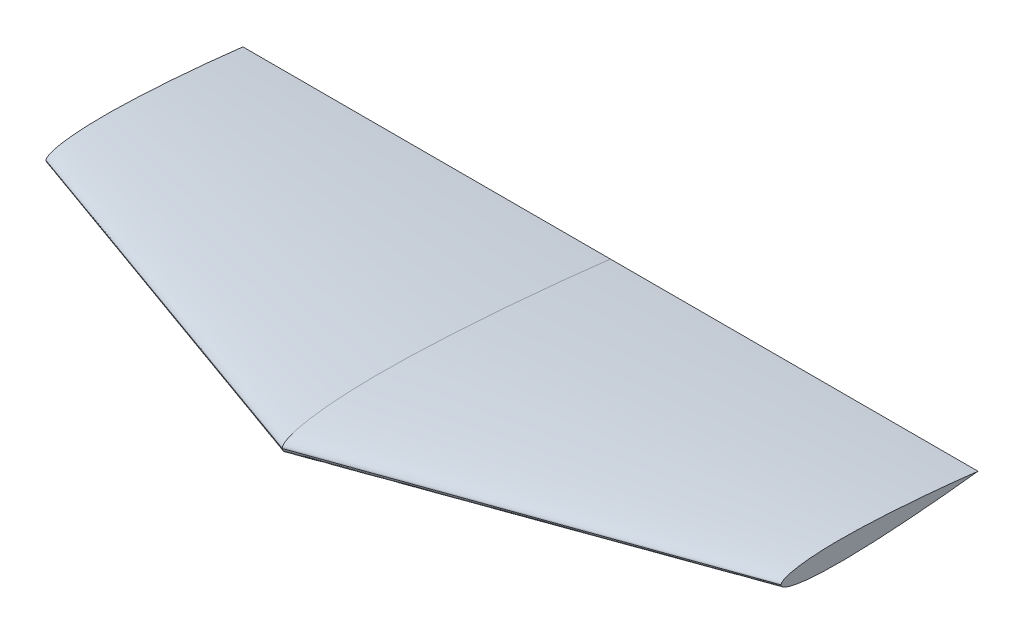
from build123d import *


with BuildPart() as part:
    # Sketch3 → Loft1 section 0
    with BuildSketch(Plane(origin=(0, 0, 0), x_dir=(0, 0, -1), z_dir=(1, 0, 0))):
        with BuildLine():
            add(Edge.make_bspline(
                [(-250, 0), (-249.999895281, 0.195763361), (-249.961151424, 0.603923402), (-249.75955923, 1.263250946), (-249.128153903, 2.239806839), (-248.109823795, 3.175235862), (-246.576102635, 4.182773144), (-244.127109162, 5.366692622), (-240.073872734, 6.817923154), (-232.840047676, 8.611288496), (-221.29446773, 10.449653683), (-205.80771311, 11.81775272), (-187.49226418, 12.532505163), (-167.615673922, 12.562370188), (-147.96130587, 12.104155942), (-127.983093335, 11.220881059), (-108.565528946, 10.107332464), (-88.272495474, 8.647865064), (-69.457807346, 7.164126414), (-48.249165687, 5.205040487), (-31.044142862, 3.54737405), (-13.203762803, 1.558807082), (-4.467222803, 0.541092362), (0, 0)],
                knots=[0, 0, 0, 0, 0, 0.0027914, 0.005882719, 0.009734657, 0.016522403, 0.022438151, 0.032158027, 0.04863424, 0.078248652, 0.129036717, 0.199997011, 0.270957307, 0.341917602, 0.412877898, 0.483838194, 0.554798491, 0.625758787, 0.696719083, 0.767679379, 0.838639675, 0.909599973, 0.909599973, 0.909599973, 0.909599973, 0.909599973], degree=4))
            add(Edge.make_bspline(
                [(-250, 0), (-249.999895281, -0.195763361), (-249.961151424, -0.603923402), (-249.75955923, -1.263250946), (-249.128153903, -2.239806839), (-248.109823795, -3.175235862), (-246.576102635, -4.182773144), (-244.127109162, -5.366692622), (-240.073872734, -6.817923154), (-232.840047676, -8.611288496), (-221.29446773, -10.449653683), (-205.80771311, -11.81775272), (-187.49226418, -12.532505163), (-167.615673922, -12.562370188), (-147.96130587, -12.104155942), (-127.983093335, -11.220881059), (-108.565528946, -10.107332464), (-88.272495474, -8.647865064), (-69.457807346, -7.164126414), (-48.249165687, -5.205040487), (-31.044142862, -3.54737405), (-13.203762803, -1.558807082), (-4.467222803, -0.541092362), (0, 0)],
                knots=[0, 0, 0, 0, 0, 0.0027914, 0.005882719, 0.009734657, 0.016522403, 0.022438151, 0.032158027, 0.04863424, 0.078248652, 0.129036717, 0.199997011, 0.270957307, 0.341917602, 0.412877898, 0.483838194, 0.554798491, 0.625758787, 0.696719083, 0.767679379, 0.838639675, 0.909599973, 0.909599973, 0.909599973, 0.909599973, 0.909599973], degree=4))
        make_face()
    # Sketch4 → Loft1 section 1
    with BuildSketch(Plane(origin=(280, 0, 0), x_dir=(0, 0, -1), z_dir=(1, 0, 0))):
        with BuildLine():
            add(Edge.make_bspline(
                [(-150, 0), (-149.999937168, 0.117458016), (-149.976690854, 0.362354041), (-149.855735538, 0.757950568), (-149.476892342, 1.343884103), (-148.865894277, 1.905141517), (-147.945661581, 2.509663886), (-146.476265497, 3.220015573), (-144.04432364, 4.090753893), (-139.704028605, 5.166773097), (-132.776680638, 6.26979221), (-123.484627866, 7.090651632), (-112.495358508, 7.519503098), (-100.569404353, 7.537422113), (-88.776783522, 7.262493565), (-76.789856001, 6.732528635), (-65.139317368, 6.064399479), (-52.963497284, 5.188719038), (-41.674684407, 4.298475849), (-28.949499412, 3.123024292), (-18.626485717, 2.12842443), (-7.922257682, 0.935284249), (-2.680333682, 0.324655417), (0, 0)],
                knots=[0, 0, 0, 0, 0, 0.0027914, 0.005882719, 0.009734657, 0.016522403, 0.022438151, 0.032158027, 0.04863424, 0.078248652, 0.129036717, 0.199997011, 0.270957307, 0.341917602, 0.412877898, 0.483838194, 0.554798491, 0.625758787, 0.696719083, 0.767679379, 0.838639675, 0.909599973, 0.909599973, 0.909599973, 0.909599973, 0.909599973], degree=4))
            add(Edge.make_bspline(
                [(-150, 0), (-149.999937169, -0.117458016), (-149.976690854, -0.362354041), (-149.855735538, -0.757950568), (-149.476892342, -1.343884103), (-148.865894277, -1.905141517), (-147.945661581, -2.509663886), (-146.476265497, -3.220015573), (-144.04432364, -4.090753893), (-139.704028605, -5.166773097), (-132.776680638, -6.26979221), (-123.484627866, -7.090651632), (-112.495358508, -7.519503098), (-100.569404353, -7.537422113), (-88.776783522, -7.262493565), (-76.789856001, -6.732528635), (-65.139317368, -6.064399479), (-52.963497285, -5.188719038), (-41.674684407, -4.298475849), (-28.949499412, -3.123024292), (-18.626485717, -2.12842443), (-7.922257682, -0.935284249), (-2.680333682, -0.324655417), (0, 0)],
                knots=[0, 0, 0, 0, 0, 0.0027914, 0.005882719, 0.009734657, 0.016522403, 0.022438151, 0.032158027, 0.04863424, 0.078248652, 0.129036717, 0.199997011, 0.270957307, 0.341917602, 0.412877898, 0.483838194, 0.554798491, 0.625758787, 0.696719083, 0.767679379, 0.838639675, 0.909599973, 0.909599973, 0.909599973, 0.909599973, 0.909599973], degree=4))
        make_face()
    loft1 = loft()

    # Mirror1: Loft1 across plane
    add(loft1.mirror(Plane(origin=(0, -11.080505768, 126.305662571), x_dir=(0, 0, 1), z_dir=(-1, 0, 0))))


solid = part.part
